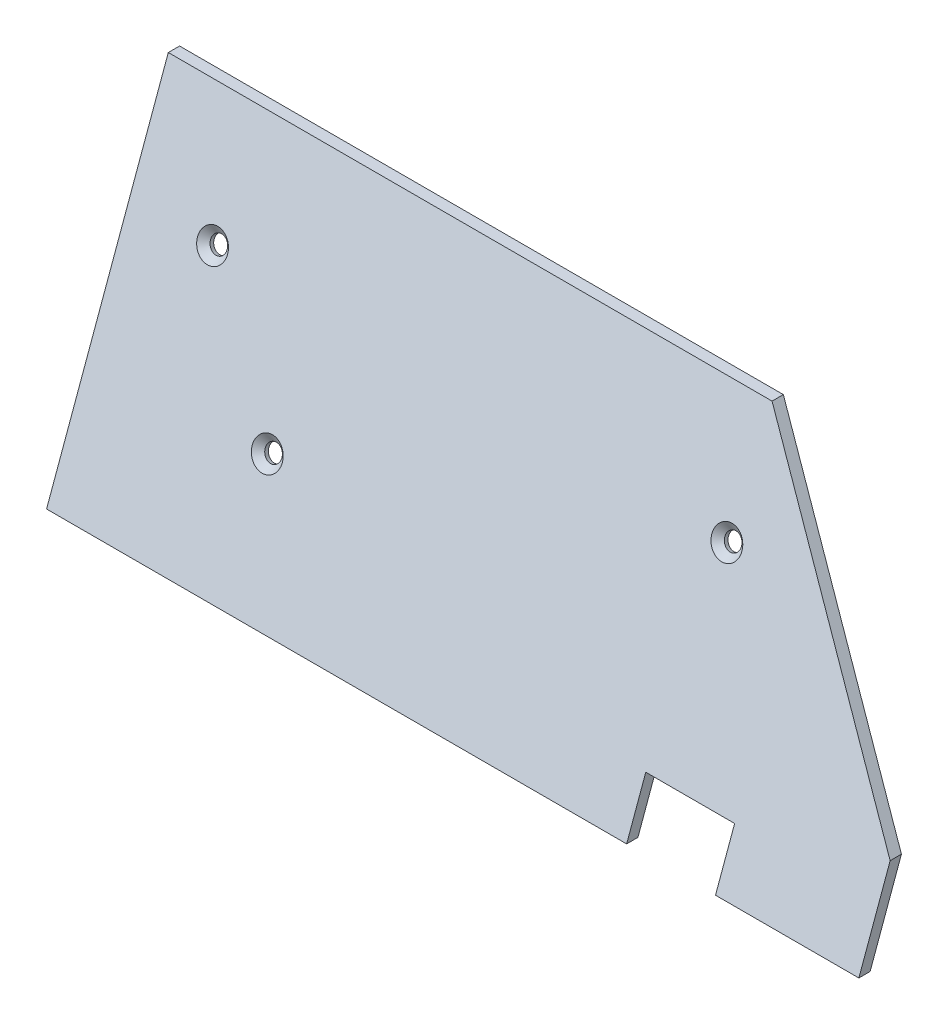
from build123d import *

# Parameters (mm, degrees)
MAIN_DEPTH                                      = 85
BACKBRACKETHOLES_D                              = 3.5
BACKBRACKETHOLES_DEPTH                          = 5
BACKBRACKETHOLES_CSINK_D                        = 6.3
BACKBRACKETHOLES_CSINK_ANGLE                    = 90
CUT_EXTRUDE1_DEPTH                              = 28.6
CSK_FOR_M3_FLAT_HEAD_MACHINE_SCREW1_D           = 3.5
CSK_FOR_M3_FLAT_HEAD_MACHINE_SCREW1_DEPTH       = 5
CSK_FOR_M3_FLAT_HEAD_MACHINE_SCREW1_CSINK_D     = 6.3
CSK_FOR_M3_FLAT_HEAD_MACHINE_SCREW1_CSINK_ANGLE = 90
CUT_EXTRUDE3_REACH                              = 145.023
CUT_EXTRUDE3_START                              = 30
SKETCH7_W                                       = 18.6
SKETCH7_H                                       = 12


with BuildPart() as part:
    # Sketch1 → Main (new, symmetric)
    with BuildSketch(Plane(origin=(0, 0, 0), x_dir=(0, 0, -1), z_dir=(1, 0, 0))):
        Polygon((0, 0), (-2.3622, 0), (23.115716399, 70), (25.477916399, 70), align=None)
    extrude(amount=MAIN_DEPTH, both=True)

    # BackBracketHoles
    with Locations(Plane(origin=(0, 0.759196446, 2.085875092), x_dir=(1, 0, 0), z_dir=(0, 0.3420201433256726, 0.9396926207859071))):
        with Locations((-67.6378, 50.002080017), (-47.6378, 25.002080017)):
            CounterSinkHole(BACKBRACKETHOLES_D / 2, BACKBRACKETHOLES_CSINK_D / 2, depth=BACKBRACKETHOLES_DEPTH, counter_sink_angle=BACKBRACKETHOLES_CSINK_ANGLE)

    # Sketch4 → Cut-Extrude1 (cut)
    with BuildSketch(Plane.XY):
        Polygon((41.356687338, 70), (100, 0.111621453), (100, 70), align=None)
    extrude(amount=-CUT_EXTRUDE1_DEPTH, mode=Mode.SUBTRACT)

    # CSK for M3 Flat Head Machine Screw1
    with Locations(Plane(origin=(0, 0.759196446, 2.085875092), x_dir=(1, 0, 0), z_dir=(0, 0.3420201433256726, 0.9396926207859071))):
        with Locations((40, 50.002080017)):
            CounterSinkHole(CSK_FOR_M3_FLAT_HEAD_MACHINE_SCREW1_D / 2, CSK_FOR_M3_FLAT_HEAD_MACHINE_SCREW1_CSINK_D / 2, depth=CSK_FOR_M3_FLAT_HEAD_MACHINE_SCREW1_DEPTH, counter_sink_angle=CSK_FOR_M3_FLAT_HEAD_MACHINE_SCREW1_CSINK_ANGLE)

    # Cut-Extrude3: up to this plane
    cut_extrude3_end = Plane(origin=(85, 70, -25.477916399), z_dir=(0, 0.3420201433256726, 0.939692620785907))
    # Sketch7 → Cut-Extrude3 (cut, up to the surface)
    with BuildSketch(Plane.XY.offset(CUT_EXTRUDE3_START), mode=Mode.PRIVATE) as cut_extrude3_sk1:
        with Locations((45.7, 5.001954577)):
            Rectangle(SKETCH7_W, SKETCH7_H)
    cut_extrude3_tool1 = split(extrude(cut_extrude3_sk1.sketch, amount=-CUT_EXTRUDE3_REACH, mode=Mode.PRIVATE), bisect_by=cut_extrude3_end, keep=Keep.BOTH, mode=Mode.PRIVATE)
    add(cut_extrude3_tool1.solids().sort_by_distance((45.7, 5.001955, 30))[0], mode=Mode.SUBTRACT)


solid = part.part
